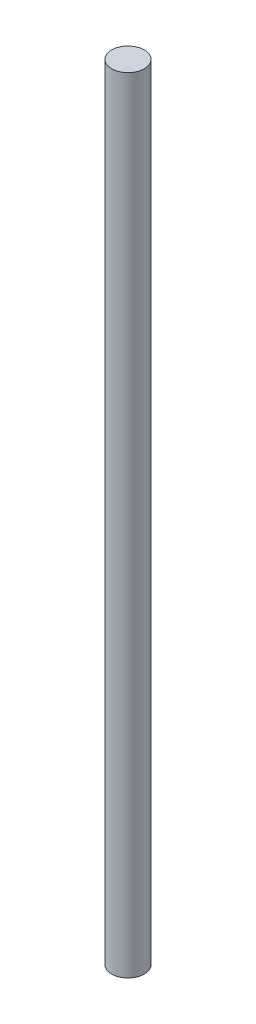
from build123d import *

# Parameters (mm, degrees)
SKETCH_1_R      = 5
EXTRUDE_1_DEPTH = 240


with BuildPart() as part:
    # Эскиз1 → Вытянуть1 (new body)
    with BuildSketch(Plane(origin=(0, 0, 0), x_dir=(1, 0, 0), z_dir=(0, 1, 0))):
        Circle(SKETCH_1_R)
    extrude(amount=EXTRUDE_1_DEPTH)


solid = part.part
